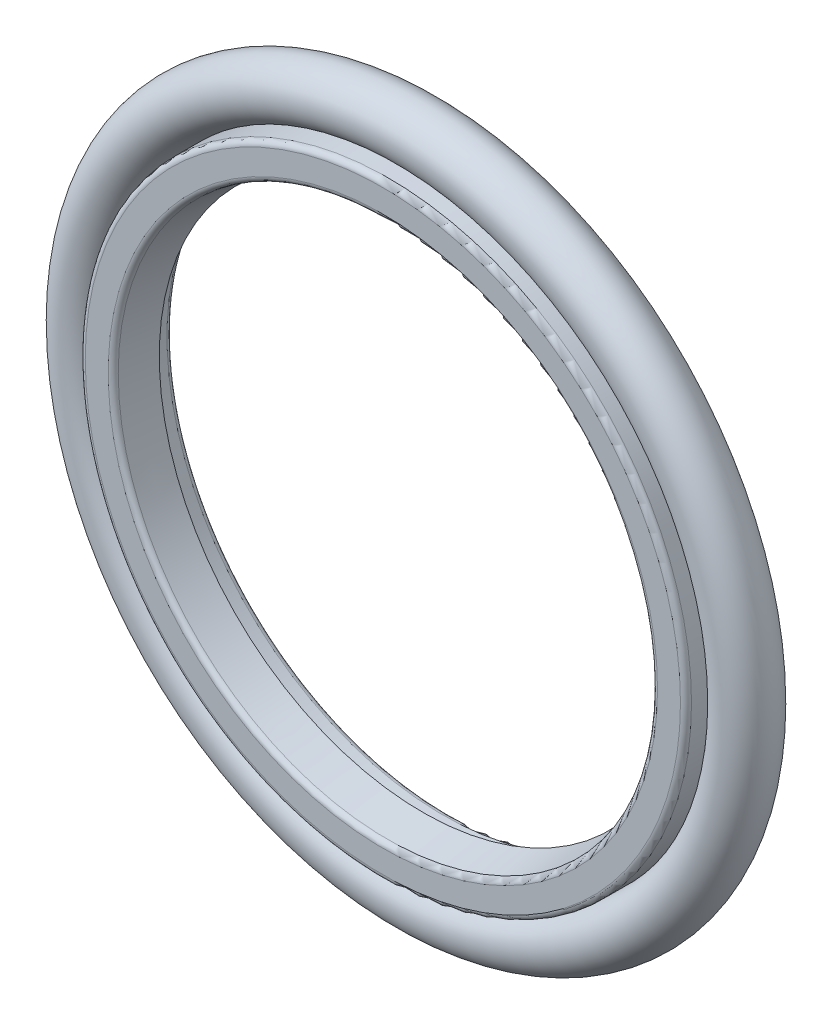
from build123d import *

# Parameters (mm, degrees)
SKETCH2_R = 1.25


with BuildPart() as part:
    # Sketch1 → Revolve1 (revolve)
    with BuildSketch(Plane(origin=(0, 0, 0), x_dir=(0, 0, -1), z_dir=(1, 0, 0))):
        with BuildLine():
            Line((0.25, 13.72), (2.75, 13.72))
            ThreePointArc((2.75, 13.72), (2.926776695, 13.646776695), (3, 13.47))
            Line((3, 13.47), (3, 12.77))
            ThreePointArc((3, 12.77), (2.926776695, 12.593223305), (2.75, 12.52))
            Line((2.75, 12.52), (2.2, 12.52))
            Line((2.2, 12.52), (1.8, 11.92))
            Line((1.8, 11.92), (0.208900253, 12.185183291))
            ThreePointArc((0.208900253, 12.185183291), (0.059245004, 12.270188048), (0, 12.431781772))
            Line((0, 12.431781772), (0, 13.47))
            ThreePointArc((0, 13.47), (0.073223305, 13.646776695), (0.25, 13.72))
        make_face()
    revolve(axis=Axis((0, 0, 0), (0, 0, -1)))


with BuildPart() as body_2:
    # Sketch2 → Revolve2 (revolve)
    with BuildSketch(Plane(origin=(0, 0, 0), x_dir=(0, 0, -1), z_dir=(1, 0, 0))):
        with Locations((1.5, 14.97)):
            Circle(SKETCH2_R)
    revolve(axis=Axis((0, 0, 0), (0, 0, -1)))


solid = Compound([part.part, body_2.part])
